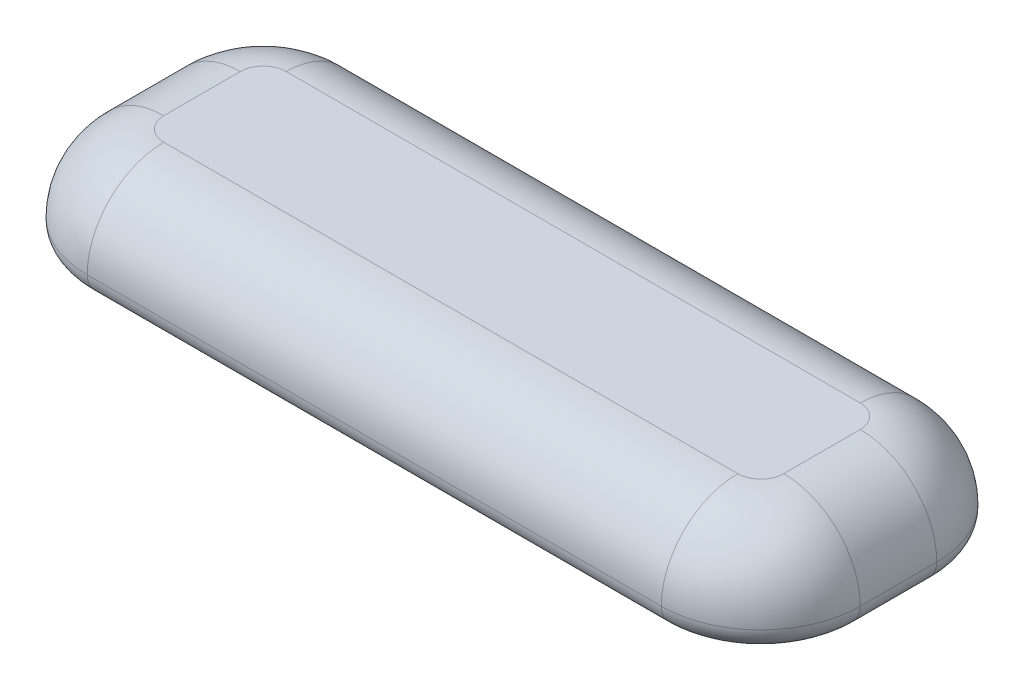
from build123d import *

# Parameters (mm, degrees)
EXTRUDE_1_DEPTH = 10
SHELL_2_T       = 3
FILLET_3_R      = 10
FILLET_4_R      = 3
SKETCH_2_R      = 2.675
EXTRUDE_2_DEPTH = 8
EXTRUDE_3_DEPTH = 4
FILLET_11_R     = 0.3
FILLET_7_R      = 5
CHAMFER_1_SIZE  = 0.2
CHAMFER_2_SIZE  = 0.2
FILLET_9_SIZE   = 5.5
FILLET_9_SIZE_2 = 5


# Some blends are built 0.0001 mm under size
with BuildPart() as part:
    # 草图1 → 凸台-拉伸1 (new body)
    with BuildSketch(Plane(origin=(0, 0, 0), x_dir=(1, 0, 0), z_dir=(0, 1, 0))):
        with BuildLine():
            Line((-37.5, 15), (37.5, 15))
            ThreePointArc((37.5, 15), (44.571067812, 12.071067812), (47.5, 5))
            Line((47.5, 5), (47.5, -5))
            ThreePointArc((47.5, -5), (44.571067812, -12.071067812), (37.5, -15))
            Line((37.5, -15), (-37.5, -15))
            ThreePointArc((-37.5, -15), (-44.571067812, -12.071067812), (-47.5, -5))
            Line((-47.5, -5), (-47.5, 5))
            ThreePointArc((-47.5, 5), (-44.571067812, 12.071067812), (-37.5, 15))
        make_face()
    extrude(amount=EXTRUDE_1_DEPTH)

    # 抽壳2
    shell_2_openings = [part.faces().sort_by_distance(p)[0] for p in [
        (0, 0, 0),
    ]]
    offset(amount=SHELL_2_T, openings=shell_2_openings, kind=Kind.INTERSECTION)

    # 圆角3
    # the kernel refuses this fillet: 10 mm, written as the material it takes off along each edge
    with BuildSketch(Plane(origin=(37.5, 13, 5), x_dir=(1, 0, 0), z_dir=(0, 0, -1))) as fillet_3_piece_1:
        with BuildLine():
            CenterArc((13 - FILLET_3_R, FILLET_3_R), FILLET_3_R, 270, 90)
            Line((13 - FILLET_3_R, 0), (13, 0))
            Line((13, 0), (13, FILLET_3_R))
        make_face()
    revolve(axis=Axis((37.5, 13, 5), (0, -1, 0)), revolution_arc=90, mode=Mode.SUBTRACT)
    with BuildSketch(Plane(origin=(50.5, 13, 5), x_dir=(0, -1, 0), z_dir=(0, 0, -1)), Plane(origin=(-50.5, 13, -5), x_dir=(0, -1, 0), z_dir=(0, 0, 1))) as fillet_3_piece_2:
        with BuildLine():
            CenterArc((FILLET_3_R, FILLET_3_R), FILLET_3_R, 180, 90)
            Line((0, FILLET_3_R), (0, 0))
            Line((0, 0), (FILLET_3_R, 0))
        make_face()
    extrude(amount=10, mode=Mode.SUBTRACT)
    with BuildSketch(Plane(origin=(37.5, 13, -5), x_dir=(0, 0, -1), z_dir=(-1, 0, 0))) as fillet_3_piece_3:
        with BuildLine():
            CenterArc((13 - FILLET_3_R, FILLET_3_R), FILLET_3_R, 270, 90)
            Line((13 - FILLET_3_R, 0), (13, 0))
            Line((13, 0), (13, FILLET_3_R))
        make_face()
    revolve(axis=Axis((37.5, 13, -5), (0, -1, 0)), revolution_arc=90, mode=Mode.SUBTRACT)
    with BuildSketch(Plane(origin=(37.5, 13, -18), x_dir=(0, -1, 0), z_dir=(-1, 0, 0)), Plane(origin=(-37.5, 13, 18), x_dir=(0, -1, 0), z_dir=(1, 0, 0))) as fillet_3_piece_4:
        with BuildLine():
            CenterArc((FILLET_3_R, FILLET_3_R), FILLET_3_R, 180, 90)
            Line((0, FILLET_3_R), (0, 0))
            Line((0, 0), (FILLET_3_R, 0))
        make_face()
    extrude(amount=75, mode=Mode.SUBTRACT)
    with BuildSketch(Plane(origin=(-37.5, 13, -5), x_dir=(-1, 0, 0), z_dir=(0, 0, 1))) as fillet_3_piece_5:
        with BuildLine():
            CenterArc((13 - FILLET_3_R, FILLET_3_R), FILLET_3_R, 270, 90)
            Line((13 - FILLET_3_R, 0), (13, 0))
            Line((13, 0), (13, FILLET_3_R))
        make_face()
    revolve(axis=Axis((-37.5, 13, -5), (0, -1, 0)), revolution_arc=90, mode=Mode.SUBTRACT)
    with BuildSketch(Plane(origin=(-37.5, 13, 5), x_dir=(0, 0, 1), z_dir=(1, 0, 0))) as fillet_3_piece_6:
        with BuildLine():
            CenterArc((13 - FILLET_3_R, FILLET_3_R), FILLET_3_R, 270, 90)
            Line((13 - FILLET_3_R, 0), (13, 0))
            Line((13, 0), (13, FILLET_3_R))
        make_face()
    revolve(axis=Axis((-37.5, 13, 5), (0, -1, 0)), revolution_arc=90, mode=Mode.SUBTRACT)

    # 圆角4
    fillet_4_edges = [part.edges().sort_by_distance(p)[0] for p in [
        (50.5, 0, 0),
        (46.692388155, 0, 14.192388155),
        (0, 0, 18),
        (-46.692388155, 0, 14.192388155),
        (-50.5, 0, 0),
        (-46.692388155, 0, -14.192388155),
        (0, 0, -18),
        (46.692388155, 0, -14.192388155),
    ]]
    fillet(fillet_4_edges, radius=FILLET_4_R - 0.0001)  # a hair under: the kernel refuses the full size

    # 草图2 → 凸台-拉伸2 (add)
    # profile 1 of 2: a face of its own
    with BuildSketch(Plane(origin=(0, 10, 0), x_dir=(-1, 0, 0), z_dir=(0, -1, 0))):
        with Locations(Location((36.8, 0, 0), (0, 0, 270))):
            Circle(SKETCH_2_R)
        Polygon((34.725, -0.575), (34.725, 0.575), (36.225, 0.575), (36.225, 2.075), (37.375, 2.075), (37.375, 0.575), (38.875, 0.575), (38.875, -0.575), (37.375, -0.575), (37.375, -2.075), (36.225, -2.075), (36.225, -0.575), align=None, mode=Mode.SUBTRACT)
    # profile 2 of 2: a face of its own
    with BuildSketch(Plane(origin=(0, 10, 0), x_dir=(-1, 0, 0), z_dir=(0, -1, 0))):
        with Locations(Location((-36.8, 0, 0), (0, 0, 90))):
            Circle(SKETCH_2_R)
        Polygon((-37.375, 0.575), (-37.375, 2.075), (-36.225, 2.075), (-36.225, 0.575), (-34.725, 0.575), (-34.725, -0.575), (-36.225, -0.575), (-36.225, -2.075), (-37.375, -2.075), (-37.375, -0.575), (-38.875, -0.575), (-38.875, 0.575), align=None, mode=Mode.SUBTRACT)
    extrude(amount=EXTRUDE_2_DEPTH)

    # 草图3 → 凸台-拉伸3 (add)
    with BuildSketch(Plane.XZ.offset(-10)):
        Polygon((-37.375, -2.075), (-36.225, -2.075), (-36.225, -0.575), (-34.725, -0.575), (-34.725, 0.575), (-36.225, 0.575), (-36.225, 2.075), (-37.375, 2.075), (-37.375, 0.575), (-38.875, 0.575), (-38.875, -0.575), (-37.375, -0.575), align=None)
        Polygon((34.725, 0.575), (34.725, -0.575), (36.225, -0.575), (36.225, -2.075), (37.375, -2.075), (37.375, -0.575), (38.875, -0.575), (38.875, 0.575), (37.375, 0.575), (37.375, 2.075), (36.225, 2.075), (36.225, 0.575), align=None)
    extrude(amount=EXTRUDE_3_DEPTH)

    # 圆角11
    fillet_11_edges = [part.edges().sort_by_distance(p)[0] for p in [
        (36.225, 4, -0.575),
        (36.225, 4, 0.575),
        (37.375, 4, 0.575),
        (37.375, 4, -0.575),
        (-37.375, 4, -0.575),
        (-37.375, 4, 0.575),
        (-36.225, 4, 0.575),
        (-36.225, 4, -0.575),
    ]]
    fillet(fillet_11_edges, radius=FILLET_11_R)

    # 圆角7
    fillet_7_edges = [part.edges().sort_by_distance(p)[0] for p in [
        (-44.571067812, 10, 12.071067812),
        (0, 10, 15),
        (44.571067812, 10, 12.071067812),
        (47.5, 10, 0),
        (44.571067812, 10, -12.071067812),
        (0, 10, -15),
        (-44.571067812, 10, -12.071067812),
        (-47.5, 10, 0),
    ]]
    fillet(fillet_7_edges, radius=FILLET_7_R)

    # 倒角1
    chamfer_1_edges = [part.edges().sort_by_distance(p)[0] for p in [
        (35.325, 2, -0.575),
        (38.875, 2, 0),
        (37.375, 2, -1.475),
        (36.8, 2, -2.075),
        (34.725, 2, 0),
        (35.325, 2, 0.575),
        (36.8, 2, 2.075),
        (36.225, 2, -1.475),
        (38.275, 2, -0.575),
        (36.225, 2, 1.475),
        (37.375, 2, 1.475),
        (38.275, 2, 0.575),
        (37.462867966, 2, 0.662867966),
        (36.137132034, 2, 0.662867966),
        (36.137132034, 2, -0.662867966),
        (37.462867966, 2, -0.662867966),
    ]]
    chamfer(chamfer_1_edges, length=CHAMFER_1_SIZE)

    # 倒角2
    chamfer_2_edges = [part.edges().sort_by_distance(p)[0] for p in [
        (-36.8, 2, -2.075),
        (-37.375, 2, -1.475),
        (-38.875, 2, 0),
        (-35.325, 2, -0.575),
        (-38.275, 2, -0.575),
        (-38.275, 2, 0.575),
        (-37.375, 2, 1.475),
        (-36.225, 2, 1.475),
        (-37.462867966, 2, 0.662867966),
        (-36.137132034, 2, 0.662867966),
        (-36.137132034, 2, -0.662867966),
        (-37.462867966, 2, -0.662867966),
        (-36.8, 2, 2.075),
        (-35.325, 2, 0.575),
        (-34.725, 2, 0),
        (-36.225, 2, -1.475),
    ]]
    chamfer(chamfer_2_edges, length=CHAMFER_2_SIZE)

    # 圆角9
    # a fillet whose section is not a circle: 5.5, 5 mm, written as the material it adds along each edge
    with BuildSketch(Plane(origin=(36.8, 10, 0), x_dir=(0, 0, -1), z_dir=(-1, 0, 0))) as fillet_9_piece_1:
        with BuildLine():
            Bezier((2.675 + FILLET_9_SIZE, 0), (2.675, 0), (2.675, FILLET_9_SIZE_2), weights=[1, 0.333333333, 1])
            Line((2.675, FILLET_9_SIZE_2), (2.675, 0))
            Line((2.675, 0), (2.675 + FILLET_9_SIZE, 0))
        make_face()
    revolve(axis=Axis((36.8, 10, 0), (0, -1, 0)))

    # 圆角10
    # a fillet whose section is not a circle: 5.5, 5 mm, written as the material it adds along each edge (its section moved 0.00015 mm through the faces so that the kernel can cut it)
    with BuildSketch(Plane(origin=(-36.8, 10, 0), x_dir=(0, 0, 1), z_dir=(1, 0, 0))) as fillet_10_piece_1:
        with BuildLine():
            Bezier((7.675, -0.00015), (2.67485, -0.00015), (2.67485, 5.5), weights=[1, 0.333333333, 1])
            Line((2.67485, 5.5), (2.56485, 5.5))
            ThreePointArc((2.56485, 5.5), (2.565, 2.75), (2.565, 0))
            Line((2.565, 0), (2.675, -0.11))
            ThreePointArc((2.675, -0.11), (5.175, -0.11), (7.675, -0.11015))
            Line((7.675, -0.11015), (7.675, -0.00015))
        make_face()
    revolve(axis=Axis((-36.8, 10, 0), (0, -1, 0)))


solid = part.part
